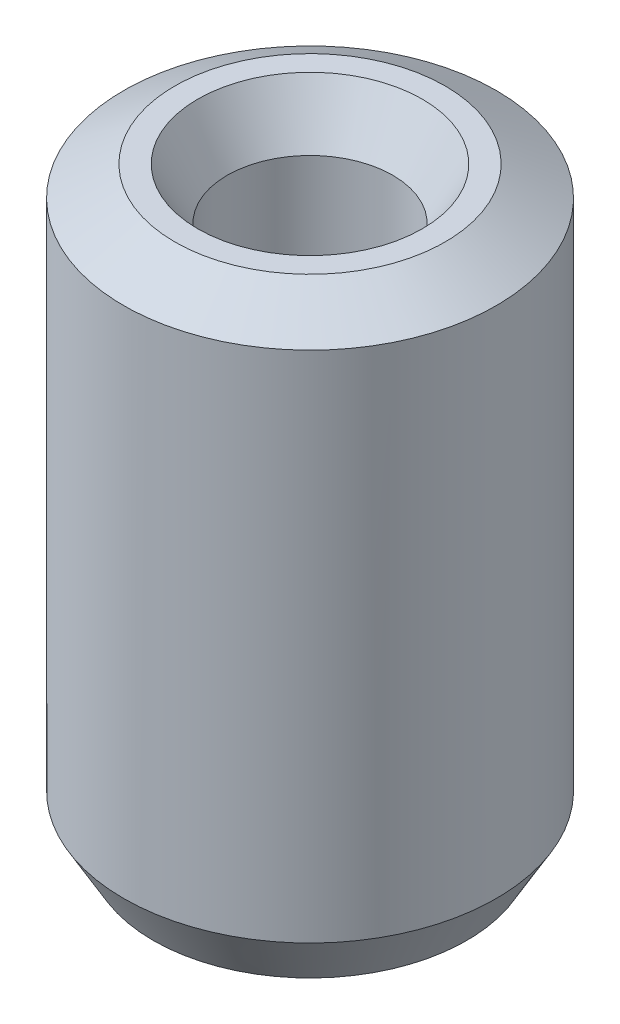
from build123d import *
from OCP.BRepFilletAPI import BRepFilletAPI_MakeChamfer

# Parameters (mm, degrees)
SKETCH1_R           = 7.5
BOSS_EXTRUDE1_DEPTH = 23.916736011
SKETCH2_R           = 3.33206507
CUT_EXTRUDE1_DEPTH  = 27.163147009
CHAMFER1_SIZE       = 1.188934759
CHAMFER1_SIZE2      = 2.05929541


with BuildPart() as part:
    # Sketch1 → Boss-Extrude1 (new body)
    with BuildSketch(Plane(origin=(0, 0, 0), x_dir=(1, 0, 0), z_dir=(0, 1, 0))):
        Circle(SKETCH1_R)
    extrude(amount=BOSS_EXTRUDE1_DEPTH)

    # Sketch2 → Cut-Extrude1 (cut, through all)
    with BuildSketch(Plane(origin=(0, 0, 0), x_dir=(1, 0, 0), z_dir=(0, 1, 0))):
        Circle(SKETCH2_R)
    extrude(amount=CUT_EXTRUDE1_DEPTH, mode=Mode.SUBTRACT)

    # Chamfer1: one chamfer whose edges measure the first distance from different faces: ONE call of the kernel's chamfer builder (chamfer() names one face for all edges)
    chamfer1_edges_1 = [part.edges().sort_by_distance(p)[0] for p in [
        (-3.33206507, 23.916736011, 0),
    ]]
    chamfer1_side_1 = [part.faces().sort_by_distance(p)[0] for p in [
        (-7.287867966, 23.916736011, 0),
    ]]
    chamfer1_edges_2 = [part.edges().sort_by_distance(p)[0] for p in [
        (-3.33206507, 0, 0),
    ]]
    chamfer1_side_2 = [part.faces().sort_by_distance(p)[0] for p in [
        (-3.33206507, 11.958368006, 0),
    ]]
    chamfer1_edges_3 = [part.edges().sort_by_distance(p)[0] for p in [
        (-7.5, 0, 0),
    ]]
    chamfer1_side_3 = [part.faces().sort_by_distance(p)[0] for p in [
        (-7.287867966, 0, 0),
    ]]
    chamfer1_edges_4 = [part.edges().sort_by_distance(p)[0] for p in [
        (-7.5, 23.916736011, 0),
    ]]
    chamfer1_side_4 = [part.faces().sort_by_distance(p)[0] for p in [
        (-7.5, 11.958368006, 0),
    ]]
    chamfer1 = BRepFilletAPI_MakeChamfer(part.part.solid().wrapped)
    for e in chamfer1_edges_1:
        chamfer1.Add(CHAMFER1_SIZE, CHAMFER1_SIZE2, e.wrapped, chamfer1_side_1[0].wrapped)  # the first distance lies on this face
    for e in chamfer1_edges_2:
        chamfer1.Add(CHAMFER1_SIZE, CHAMFER1_SIZE2, e.wrapped, chamfer1_side_2[0].wrapped)  # the first distance lies on this face
    for e in chamfer1_edges_3:
        chamfer1.Add(CHAMFER1_SIZE, CHAMFER1_SIZE2, e.wrapped, chamfer1_side_3[0].wrapped)  # the first distance lies on this face
    for e in chamfer1_edges_4:
        chamfer1.Add(CHAMFER1_SIZE, CHAMFER1_SIZE2, e.wrapped, chamfer1_side_4[0].wrapped)  # the first distance lies on this face
    add(Compound.cast(chamfer1.Shape()), mode=Mode.REPLACE)


solid = part.part
